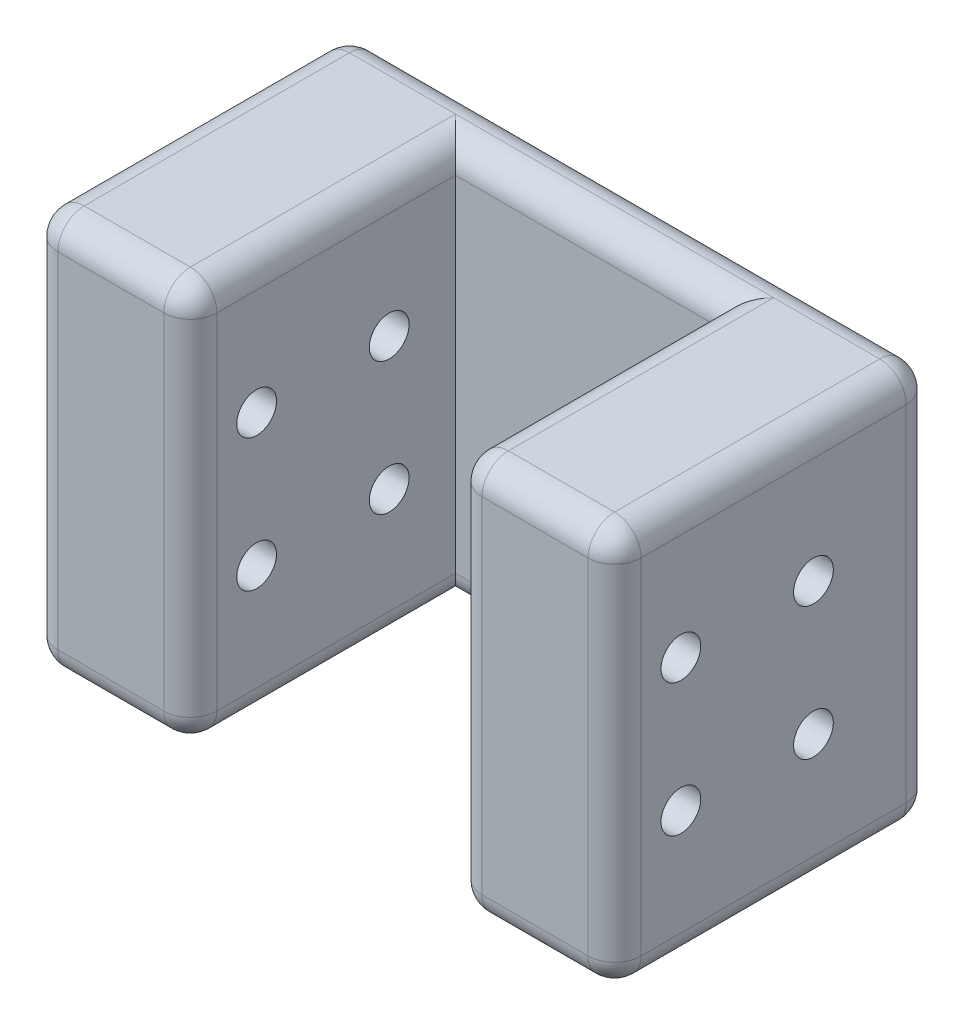
from build123d import *

# Parameters (mm, degrees)
SKETCH_1_W          = 44
SKETCH_1_H          = 30
EXTRUDE_1_DEPTH     = 24
SKETCH_5_W          = 20
SKETCH_5_H          = 34.070761632
CUT_EXTRUDE_3_DEPTH = 20
SKETCH_6_R          = 1.5
CUT_EXTRUDE_4_DEPTH = 44
FILLET_1_R          = 2
FILLET_2_R          = 2


# Some blends are built 0.0001 mm under size
with BuildPart() as part:
    # 草图1 → 凸台-拉伸1 (new body)
    with BuildSketch(Plane.XY):
        Rectangle(SKETCH_1_W, SKETCH_1_H)
    extrude(amount=EXTRUDE_1_DEPTH)

    # 草图5 → 切除-拉伸3 (cut)
    with BuildSketch(Plane.XY.offset(24)):
        with Locations((0, 0.619885825)):
            Rectangle(SKETCH_5_W, SKETCH_5_H)
    extrude(amount=-CUT_EXTRUDE_3_DEPTH, mode=Mode.SUBTRACT)

    # 草图6 → 切除-拉伸4 (cut)
    with BuildSketch(Plane(origin=(22, 0, 0), x_dir=(0, 0, -1), z_dir=(1, 0, 0))):
        with Locations((-19, 5)):
            Circle(SKETCH_6_R)
        with Locations((-19, -5)):
            Circle(SKETCH_6_R)
        with Locations((-9, -5)):
            Circle(SKETCH_6_R)
        with Locations((-9, 5)):
            Circle(SKETCH_6_R)
    extrude(amount=-CUT_EXTRUDE_4_DEPTH, mode=Mode.SUBTRACT)

    # 圆角1
    fillet_1_edges = [part.edges().sort_by_distance(p)[0] for p in [
        (-16, -15, 24),
        (-16, 15, 24),
        (16, -15, 24),
        (0, -15, 4),
        (0, 15, 4),
        (-10, 15, 14),
        (-10, -15, 14),
        (10, 15, 14),
        (10, -15, 14),
        (0, -15, 0),
        (0, 15, 0),
        (16, 15, 24),
        (22, -15, 12),
        (-22, -15, 12),
        (-22, 15, 12),
        (22, 15, 12),
    ]]
    fillet(fillet_1_edges, radius=FILLET_1_R - 0.0001)  # a hair under: the kernel refuses the full size

    # 圆角2
    # the kernel refuses this fillet: 2 mm, written as the material it takes off along each edge
    with BuildSketch(Plane(origin=(-12, -15, 22), x_dir=(1, 0, 0), z_dir=(0, 0, -1))) as fillet_2_piece_1:
        with BuildLine():
            CenterArc((0.0001, -1.9999), 1.9999, 0, 90)
            Line((2, -1.9999), (2, 0))
            Line((2, 0), (0.0001, 0))
        make_face()
    revolve(axis=Axis((-12, -15, 22), (0, -1, 0)), revolution_arc=90, mode=Mode.SUBTRACT)
    with BuildSketch(Plane(origin=(-20, -15, 22), x_dir=(0, 0, 1), z_dir=(1, 0, 0))) as fillet_2_piece_2:
        with BuildLine():
            CenterArc((0.0001, -1.9999), 1.9999, 0, 90)
            Line((2, -1.9999), (2, 0))
            Line((2, 0), (0.0001, 0))
        make_face()
    revolve(axis=Axis((-20, -15, 22), (0, -1, 0)), revolution_arc=90, mode=Mode.SUBTRACT)
    with BuildSketch(Plane(origin=(-20, -15, 2), x_dir=(-1, 0, 0), z_dir=(0, 0, 1))) as fillet_2_piece_3:
        with BuildLine():
            CenterArc((0.0001, -1.9999), 1.9999, 0, 90)
            Line((2, -1.9999), (2, 0))
            Line((2, 0), (0.0001, 0))
        make_face()
    revolve(axis=Axis((-20, -15, 2), (0, -1, 0)), revolution_arc=90, mode=Mode.SUBTRACT)
    with BuildSketch(Plane(origin=(20, -15, 2), x_dir=(0, 0, -1), z_dir=(-1, 0, 0))) as fillet_2_piece_4:
        with BuildLine():
            CenterArc((0.0001, -1.9999), 1.9999, 0, 90)
            Line((2, -1.9999), (2, 0))
            Line((2, 0), (0.0001, 0))
        make_face()
    revolve(axis=Axis((20, -15, 2), (0, -1, 0)), revolution_arc=90, mode=Mode.SUBTRACT)
    with BuildSketch(Plane(origin=(12, -15, 22), x_dir=(0, 0, 1), z_dir=(1, 0, 0))) as fillet_2_piece_5:
        with BuildLine():
            CenterArc((0.0001, -1.9999), 1.9999, 0, 90)
            Line((2, -1.9999), (2, 0))
            Line((2, 0), (0.0001, 0))
        make_face()
    revolve(axis=Axis((12, -15, 22), (0, -1, 0)), revolution_arc=90, mode=Mode.SUBTRACT)
    with BuildSketch(Plane(origin=(20, -15, 22), x_dir=(1, 0, 0), z_dir=(0, 0, -1))) as fillet_2_piece_6:
        with BuildLine():
            CenterArc((0.0001, -1.9999), 1.9999, 0, 90)
            Line((2, -1.9999), (2, 0))
            Line((2, 0), (0.0001, 0))
        make_face()
    revolve(axis=Axis((20, -15, 22), (0, -1, 0)), revolution_arc=90, mode=Mode.SUBTRACT)
    with BuildSketch(Plane(origin=(12, 15, 22), x_dir=(-1, 0, 0), z_dir=(0, 0, -1))) as fillet_2_piece_7:
        with BuildLine():
            CenterArc((0.0001, -1.9999), 1.9999, 0, 90)
            Line((2, -1.9999), (2, 0))
            Line((2, 0), (0.0001, 0))
        make_face()
    revolve(axis=Axis((12, 15, 22), (0, 1, 0)), revolution_arc=90, mode=Mode.SUBTRACT)
    with BuildSketch(Plane(origin=(20, 15, 22), x_dir=(0, 0, 1), z_dir=(-1, 0, 0))) as fillet_2_piece_8:
        with BuildLine():
            CenterArc((0.0001, -1.9999), 1.9999, 0, 90)
            Line((2, -1.9999), (2, 0))
            Line((2, 0), (0.0001, 0))
        make_face()
    revolve(axis=Axis((20, 15, 22), (0, 1, 0)), revolution_arc=90, mode=Mode.SUBTRACT)
    with BuildSketch(Plane(origin=(-12, 15, 22), x_dir=(0, 0, 1), z_dir=(-1, 0, 0))) as fillet_2_piece_9:
        with BuildLine():
            CenterArc((0.0001, -1.9999), 1.9999, 0, 90)
            Line((2, -1.9999), (2, 0))
            Line((2, 0), (0.0001, 0))
        make_face()
    revolve(axis=Axis((-12, 15, 22), (0, 1, 0)), revolution_arc=90, mode=Mode.SUBTRACT)
    with BuildSketch(Plane(origin=(20, 15, 2), x_dir=(1, 0, 0), z_dir=(0, 0, 1))) as fillet_2_piece_10:
        with BuildLine():
            CenterArc((0.0001, -1.9999), 1.9999, 0, 90)
            Line((2, -1.9999), (2, 0))
            Line((2, 0), (0.0001, 0))
        make_face()
    revolve(axis=Axis((20, 15, 2), (0, 1, 0)), revolution_arc=90, mode=Mode.SUBTRACT)
    with BuildSketch(Plane(origin=(-20, 15, 22), x_dir=(-1, 0, 0), z_dir=(0, 0, -1))) as fillet_2_piece_11:
        with BuildLine():
            CenterArc((0.0001, -1.9999), 1.9999, 0, 90)
            Line((2, -1.9999), (2, 0))
            Line((2, 0), (0.0001, 0))
        make_face()
    revolve(axis=Axis((-20, 15, 22), (0, 1, 0)), revolution_arc=90, mode=Mode.SUBTRACT)
    with BuildSketch(Plane(origin=(-20, 15, 2), x_dir=(0, 0, -1), z_dir=(1, 0, 0))) as fillet_2_piece_12:
        with BuildLine():
            CenterArc((0.0001, -1.9999), 1.9999, 0, 90)
            Line((2, -1.9999), (2, 0))
            Line((2, 0), (0.0001, 0))
        make_face()
    revolve(axis=Axis((-20, 15, 2), (0, 1, 0)), revolution_arc=90, mode=Mode.SUBTRACT)
    with BuildSketch(Plane(origin=(-22, 15, 0), x_dir=(0, 0, 1), z_dir=(0, -1, 0)), Plane(origin=(-22, 15, 24), x_dir=(1, 0, 0), z_dir=(0, -1, 0)), Plane(origin=(10, -15, 24), x_dir=(0, 0, -1), z_dir=(0, 1, 0))) as fillet_2_piece_13:
        with BuildLine():
            CenterArc((FILLET_2_R, -FILLET_2_R), FILLET_2_R, 90, 90)
            Line((0, -FILLET_2_R), (0, 0))
            Line((0, 0), (FILLET_2_R, 0))
        make_face()
    extrude(amount=30, mode=Mode.SUBTRACT)
    with BuildSketch(Plane(origin=(22, -15, 0), x_dir=(-1, 0, 0), z_dir=(0, 1, 0)), Plane(origin=(22, -15, 24), x_dir=(0, 0, -1), z_dir=(0, 1, 0)), Plane(origin=(-10, 15, 24), x_dir=(-1, 0, 0), z_dir=(0, -1, 0))) as fillet_2_piece_14:
        with BuildLine():
            CenterArc((FILLET_2_R, FILLET_2_R), FILLET_2_R, 180, 90)
            Line((0, FILLET_2_R), (0, 0))
            Line((0, 0), (FILLET_2_R, 0))
        make_face()
    extrude(amount=30, mode=Mode.SUBTRACT)


solid = part.part
